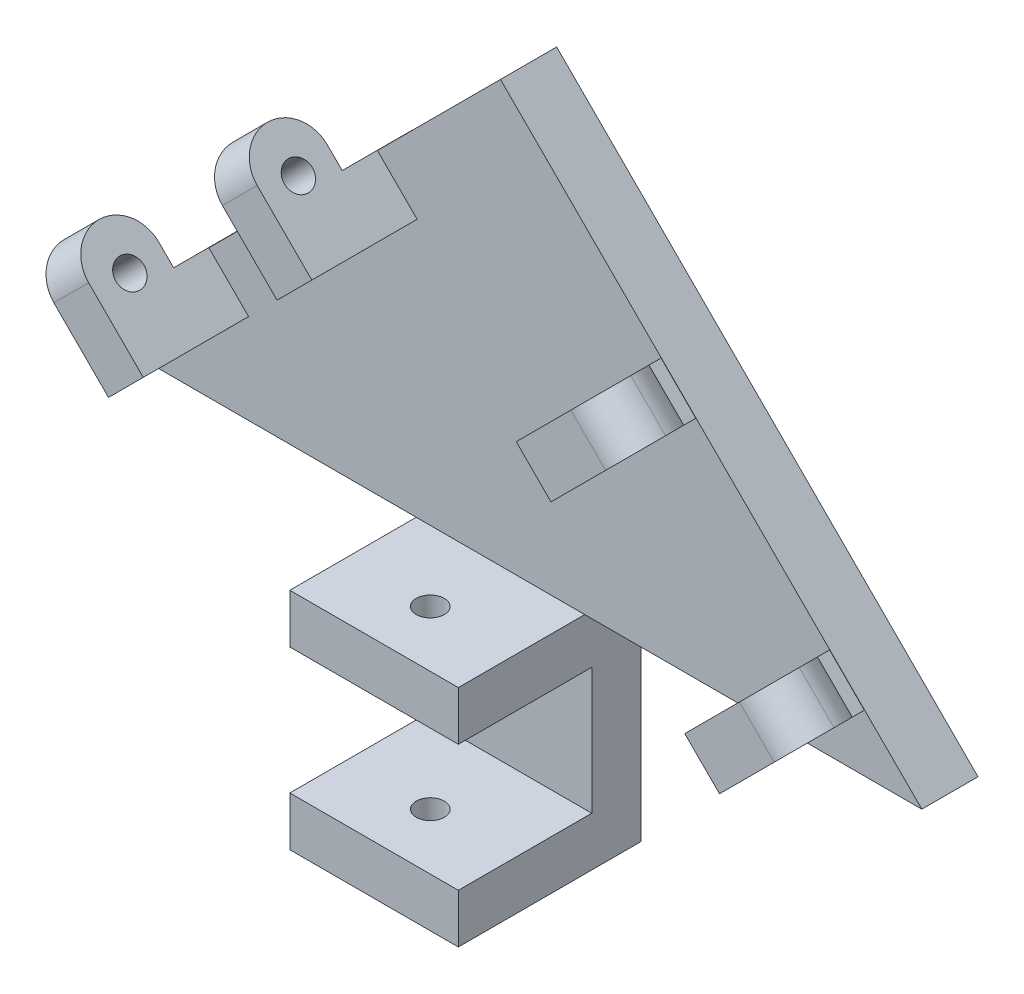
from build123d import *

# Parameters (mm, degrees)
BOSS_EXTRUDE1_DEPTH   = 4
BOSS_EXTRUDE2_START   = -4
SKETCH2_W             = 12
SKETCH2_H             = 16
BOSS_EXTRUDE2_DEPTH   = 13
SKETCH3_W             = 12
SKETCH3_H             = 9
CUT_EXTRUDE1_DEPTH    = 9.5
SKETCH4_R             = 1
CUT_EXTRUDE2_DEPTH    = 16
BOSS_EXTRUDE3_START   = 2.5
BOSS_EXTRUDE3_DEPTH   = 5
BOSS_EXTRUDE3_2_DEPTH = 5
BOSS_EXTRUDE3_3_DEPTH = 5
BOSS_EXTRUDE3_4_DEPTH = 5
BOSS_EXTRUDE4_DEPTH   = 10
SKETCH6_R             = 1
CUT_EXTRUDE5_DEPTH    = 25
SKETCH7_R             = 1
CUT_EXTRUDE6_DEPTH    = 25
FILLET2_R             = 2.5


with BuildPart() as part:
    # Sketch1 → Boss-Extrude1 (new body)
    with BuildSketch(Plane.XY):
        Polygon((-30, 0), (30, 0), (0, 30), align=None)
    extrude(amount=BOSS_EXTRUDE1_DEPTH)

    # Sketch2 → Boss-Extrude2 (add)
    with BuildSketch(Plane.XY.offset(4).offset(BOSS_EXTRUDE2_START)):
        with Locations((0, -8)):
            Rectangle(SKETCH2_W, SKETCH2_H)
    extrude(amount=BOSS_EXTRUDE2_DEPTH)

    # Sketch3 → Cut-Extrude1 (cut)
    with BuildSketch(Plane.XY.offset(13)):
        with Locations((0, -8)):
            Rectangle(SKETCH3_W, SKETCH3_H)
    extrude(amount=-CUT_EXTRUDE1_DEPTH, mode=Mode.SUBTRACT)

    # Sketch4 → Cut-Extrude2 (cut)
    with BuildSketch(Plane.XZ.offset(16)):
        with Locations(Location((0, 9, 0), (0, 0, 270))):
            Circle(SKETCH4_R)
    extrude(amount=-CUT_EXTRUDE2_DEPTH, mode=Mode.SUBTRACT)



with BuildPart() as body_2:
    # Sketch5 → Boss-Extrude3 (new body)
    with BuildSketch(Plane.XY.offset(4).offset(BOSS_EXTRUDE3_START)):
        Polygon((-8.409009742, 15.934136008), (-14.065863992, 21.590990258), (-11.590990258, 24.065863992), (-5.934136008, 18.409009742), align=None)
    extrude(amount=BOSS_EXTRUDE3_DEPTH)


with BuildPart() as body_3:
    # Sketch5 → Boss-Extrude3 2 (new body)
    with BuildSketch(Plane.XY.offset(4).offset(BOSS_EXTRUDE3_START)):
        Polygon((-20.409009742, 3.934136008), (-26.065863992, 9.590990258), (-23.590990258, 12.065863992), (-17.934136008, 6.409009742), align=None)
    extrude(amount=BOSS_EXTRUDE3_2_DEPTH)


with BuildPart() as body_4:
    # Sketch5 → Boss-Extrude3 3 (new body)
    with BuildSketch(Plane.XY.offset(4).offset(BOSS_EXTRUDE3_START)):
        Polygon((8.621141777, 15.722003974), (14.277996026, 21.378858223), (16.75286976, 18.903984489), (11.096015511, 13.24713024), align=None)
    extrude(amount=BOSS_EXTRUDE3_3_DEPTH)


with BuildPart() as body_5:
    # Sketch5 → Boss-Extrude3 4 (new body)
    with BuildSketch(Plane.XY.offset(4).offset(BOSS_EXTRUDE3_START)):
        Polygon((20.621141777, 3.722003974), (26.277996026, 9.378858223), (28.75286976, 6.903984489), (23.096015511, 1.24713024), align=None)
    extrude(amount=BOSS_EXTRUDE3_4_DEPTH)


with BuildPart() as part_1:
    add(part.part)

    add(body_2.part)  # Boss-Extrude4 merges body 2

    add(body_3.part)  # Boss-Extrude4 merges body 3

    add(body_4.part)  # Boss-Extrude4 merges body 4

    add(body_5.part)  # Boss-Extrude4 merges body 5
    # Sketch8 → Boss-Extrude4 (add)
    with BuildSketch(Plane.XY.offset(11.5)):
        Polygon((-20.409009742, 3.934136008), (-17.934136008, 6.409009742), (-20.77228069, 9.247154424), (-23.247154424, 6.77228069), align=None)
        Polygon((-8.409009742, 15.934136008), (-5.934136008, 18.409009742), (-8.770090905, 21.24496464), (-11.24496464, 18.770090905), align=None)
        Polygon((8.621141777, 15.722003974), (11.096015511, 13.24713024), (13.908555635, 16.059670364), (11.433681901, 18.534544098), align=None)
        Polygon((23.096015511, 1.24713024), (20.621141777, 3.722003974), (23.433669477, 6.534531674), (25.908543211, 4.05965794), align=None)
    extrude(amount=-BOSS_EXTRUDE4_DEPTH)

    # Sketch6 → Cut-Extrude5 (cut)
    with BuildSketch(Plane(origin=(10.924442636, -10.924442636, 0), x_dir=(0.7071067811865506, 0.7071067811865446, 0), z_dir=(0.7071067811865446, -0.7071067811865506, 0))):
        with Locations((22.098203436, 9)):
            Circle(SKETCH6_R)
    extrude(amount=-CUT_EXTRUDE5_DEPTH, mode=Mode.SUBTRACT)

    # Sketch7 → Cut-Extrude6 (cut)
    with BuildSketch(Plane(origin=(-8.237436867, -8.237436867, 0), x_dir=(0, 0, 1), z_dir=(-0.7071067811865501, -0.7071067811865449, 0))):
        with Locations(Location((9, 22.098203436, 0), (0, 0, 270))):
            Circle(SKETCH7_R)
    extrude(amount=-CUT_EXTRUDE6_DEPTH, mode=Mode.SUBTRACT)

    # Fillet2
    fillet2_edges = [part_1.edges().sort_by_distance(p)[0] for p in [
        (15.515432893, 20.141421356, 11.5),
        (15.515432893, 20.141421356, 6.5),
        (27.515432893, 8.141421356, 6.5),
        (27.515432893, 8.141421356, 11.5),
        (-24.828427125, 10.828427125, 6.5),
        (-12.828427125, 22.828427125, 6.5),
        (-12.828427125, 22.828427125, 11.5),
        (-24.828427125, 10.828427125, 11.5),
    ]]
    fillet(fillet2_edges, radius=FILLET2_R - 0.0001)  # a hair under: the kernel refuses the full size


solid = part_1.part
